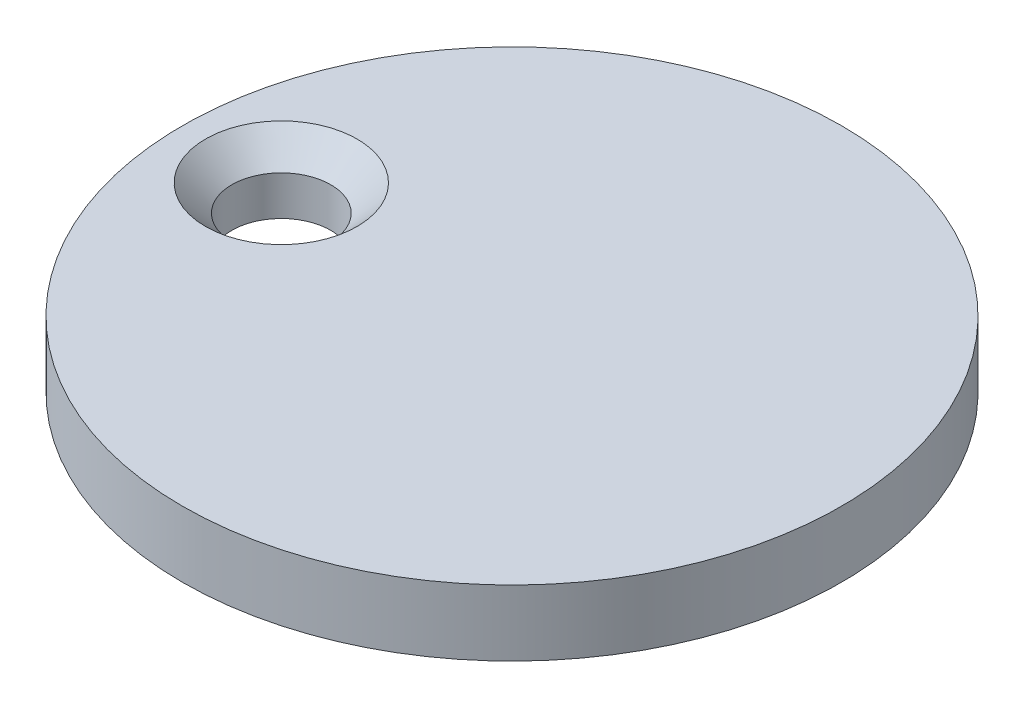
from build123d import *

# Parameters (mm, degrees)
SKETCH1_R           = 50
SKETCH1_R_2         = 7.5
BOSS_EXTRUDE1_DEPTH = 10
CHAMFER1_SIZE       = 4


with BuildPart() as part:
    # Sketch1 → Boss-Extrude1 (new body)
    with BuildSketch(Plane(origin=(0, 0, 0), x_dir=(1, 0, 0), z_dir=(0, 1, 0))):
        Circle(SKETCH1_R)
        with Locations((-35, 0)):
            Circle(SKETCH1_R_2, mode=Mode.SUBTRACT)
    extrude(amount=BOSS_EXTRUDE1_DEPTH)

    # Chamfer1
    chamfer1_edges = [part.edges().sort_by_distance(p)[0] for p in [
        (-42.5, 10, 0),
    ]]
    chamfer(chamfer1_edges, length=CHAMFER1_SIZE)


solid = part.part
